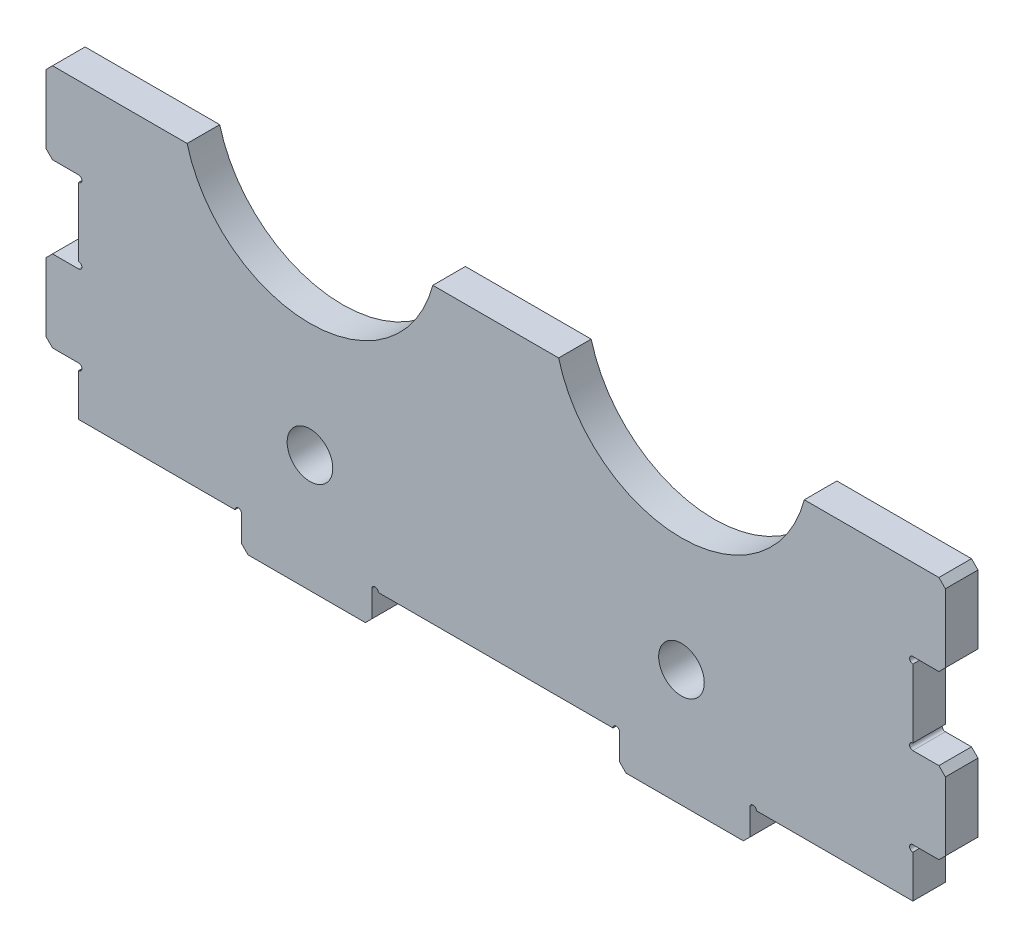
from build123d import *

# Parameters (mm, degrees)
ESQUISSE1_W                               = 256
ESQUISSE1_H                               = 100
T_LE_DE_BASE_PLI_E1_DEPTH                 = 10
ENL_V_MAT_EXTRU_1_DEPTH                   = 10
TROU_POUR_TARAUDAGE_POUR_TROU_TARAUD_M1_D = 14
TAB_START                                 = -10
TAB_AND_SLOT_TAB1_DEPTH                   = 10
TAB_AND_SLOT_TAB2_DEPTH                   = 10
TAB_AND_SLOT_TAB3_DEPTH                   = 10
ESQUISSE17_W                              = 256
ESQUISSE17_H                              = 10
ENL_V_MAT_EXTRU_2_DEPTH                   = 10
DIAM_TRE_DU_PER_AGE_2_0_2_1_D             = 2


# Read off the part's stored shape, not the designer's step: Tab and Slot-Tab1, Tab and Slot-Tab2, Tab and Slot-Tab3
# Sheet-metal steps are written as plain solids
with BuildPart() as part:
    # Esquisse1 → Tôle de base pliée1 (new body)
    with BuildSketch(Plane.XY):
        with Locations((128, 50)):
            Rectangle(ESQUISSE1_W, ESQUISSE1_H)
    extrude(amount=-T_LE_DE_BASE_PLI_E1_DEPTH)

    # Esquisse9 → Enlèv. mat.-Extru.1 (cut)
    with BuildSketch(Plane.XY):
        with BuildLine():
            Line((32, 100), (110, 100))
            ThreePointArc((110, 100), (71, 139), (32, 100))
        make_face()
        with BuildLine():
            ThreePointArc((32, 100), (71, 61), (110, 100))
            Line((110, 100), (32, 100))
        make_face()
        with BuildLine():
            ThreePointArc((224, 100), (185, 139), (146, 100))
            Line((146, 100), (224, 100))
        make_face()
        with BuildLine():
            Line((224, 100), (146, 100))
            ThreePointArc((146, 100), (185, 61), (224, 100))
        make_face()
    extrude(amount=-ENL_V_MAT_EXTRU_1_DEPTH, mode=Mode.SUBTRACT)

    # Trou pour taraudage pour trou taraudé M161 (through all)
    with Locations(Plane.XY):
        with Locations((71, 26), (185, 26)):
            Hole(TROU_POUR_TARAUDAGE_POUR_TROU_TARAUD_M1_D / 2)

    # Tab and Slot-Tab1 outline → Tab and Slot-Tab1 (add)
    with BuildSketch(Plane.XY.offset(TAB_START)):
        Polygon((204, -10), (206, -8), (206, 0), (166, 0), (166, -8), (168, -10), align=None)
        Polygon((90, -8), (90, 0), (50, 0), (50, -8), (52, -10), (88, -10), align=None)
    extrude(amount=TAB_AND_SLOT_TAB1_DEPTH)

    # Tab and Slot-Tab2 outline → Tab and Slot-Tab2 (add)
    with BuildSketch(Plane.XY.offset(TAB_START)):
        Polygon((-10, 17), (-8, 15), (0, 15), (0, 40), (-8, 40), (-10, 38), align=None)
        Polygon((-8, 65), (0, 65), (0, 90), (-8, 90), (-10, 88), (-10, 67), align=None)
    extrude(amount=TAB_AND_SLOT_TAB2_DEPTH)

    # Tab and Slot-Tab3 outline → Tab and Slot-Tab3 (add)
    with BuildSketch(Plane.XY.offset(TAB_START)):
        Polygon((256, 90), (256, 65), (264, 65), (266, 67), (266, 88), (264, 90), align=None)
        Polygon((256, 15), (264, 15), (266, 17), (266, 38), (264, 40), (256, 40), align=None)
    extrude(amount=TAB_AND_SLOT_TAB3_DEPTH)

    # Esquisse17 → Enlèv. mat.-Extru.2 (cut)
    with BuildSketch(Plane.XY):
        with Locations((128, 95)):
            Rectangle(ESQUISSE17_W, ESQUISSE17_H)
    extrude(amount=-ENL_V_MAT_EXTRU_2_DEPTH, mode=Mode.SUBTRACT)

    # Diamètre du perçage Ø2.0 (2)1 (through all)
    with Locations(Plane.XY):
        with Locations((256, 64)):
            diam_tre_du_per_age_2_0_2_1 = Hole(DIAM_TRE_DU_PER_AGE_2_0_2_1_D / 2)

    # Répét. par esquisse1: Diamètre du perçage Ø2.0 (2)1 at 9 more places
    with Locations((-256, 0, 0), (-256, -23, 0), (-256, -50, 0), (-207, -64, 0), (-165, -64, 0), (-91, -64, 0), (-49, -64, 0), (0, -50, 0), (0, -23, 0)):
        add(diam_tre_du_per_age_2_0_2_1, mode=Mode.SUBTRACT)


solid = part.part
